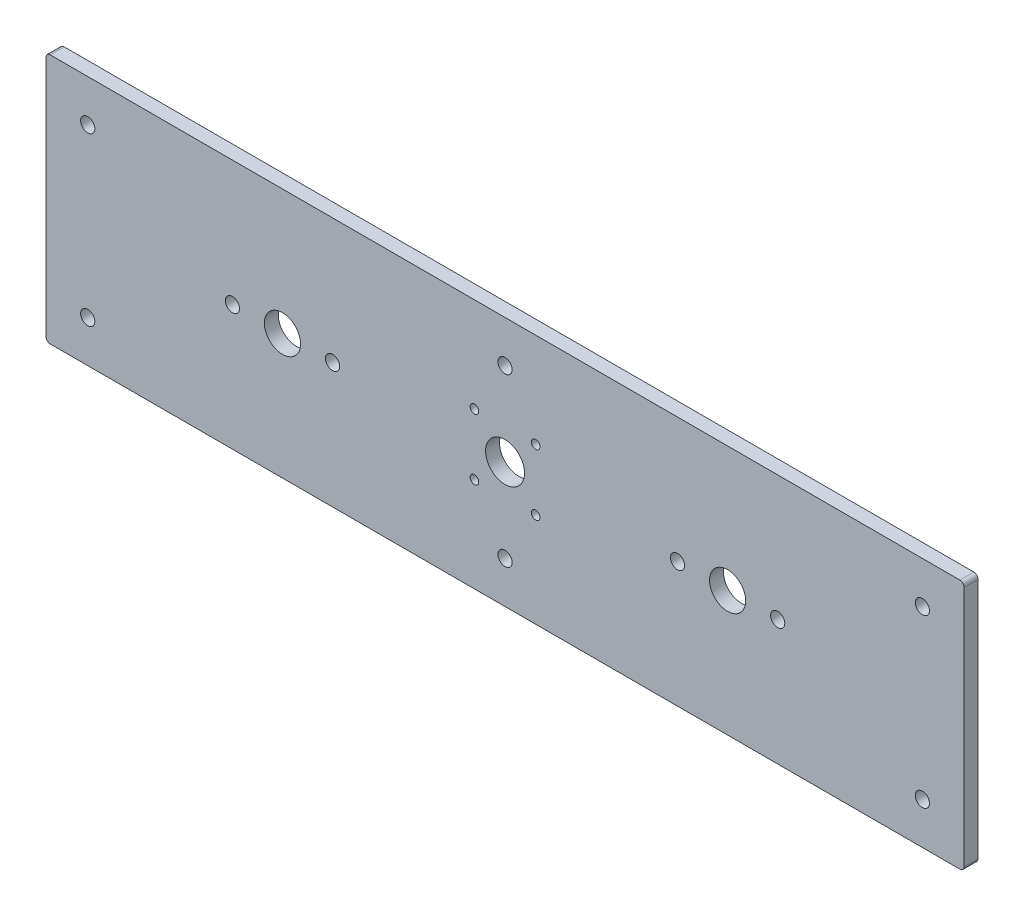
from build123d import *

# Parameters (mm, degrees)
SKETCH1_W           = 330
SKETCH1_H           = 90
BOSS_EXTRUDE1_DEPTH = 2.5
SKETCH2_R           = 2.55
CUT_EXTRUDE1_DEPTH  = 172.099386323
SKETCH3_R           = 6.5
SKETCH3_R_2         = 2.55
CUT_EXTRUDE2_DEPTH  = 172.099386323
SKETCH4_R           = 1.55
SKETCH4_R_2         = 7
CUT_EXTRUDE3_DEPTH  = 172.099386323
FILLET1_R           = 1.5


with BuildPart() as part:
    # Sketch1 → Boss-Extrude1 (new, symmetric)
    with BuildSketch(Plane.XY):
        Rectangle(SKETCH1_W, SKETCH1_H)
    extrude(amount=BOSS_EXTRUDE1_DEPTH, both=True)

    # Sketch2 → Cut-Extrude1 (cut, through all)
    with BuildSketch(Plane.XY.offset(2.5)):
        with Locations((150, 30)):
            Circle(SKETCH2_R)
        with Locations((150, -30)):
            Circle(SKETCH2_R)
        with Locations((0, 30)):
            Circle(SKETCH2_R)
        with Locations((0, -30)):
            Circle(SKETCH2_R)
        with Locations((-150, -30)):
            Circle(SKETCH2_R)
        with Locations((-150, 30)):
            Circle(SKETCH2_R)
    extrude(amount=-CUT_EXTRUDE1_DEPTH, mode=Mode.SUBTRACT)

    # Sketch3 → Cut-Extrude2 (cut, through all)
    with BuildSketch(Plane.XY.offset(2.5)):
        with Locations((-80, 0)):
            Circle(SKETCH3_R)
        with Locations((-62, 0)):
            Circle(SKETCH3_R_2)
        with Locations((-98, 0)):
            Circle(SKETCH3_R_2)
    cut_extrude2 = extrude(amount=-CUT_EXTRUDE2_DEPTH, mode=Mode.SUBTRACT)

    # Mirror1: Cut-Extrude2 across plane
    add(cut_extrude2.mirror(Plane(origin=(0, 0, 0), x_dir=(0, 0, 1), z_dir=(1, 0, 0))), mode=Mode.SUBTRACT)

    # Sketch4 → Cut-Extrude3 (cut, through all)
    with BuildSketch(Plane.XY.offset(2.5)):
        with Locations((11, 11)):
            Circle(SKETCH4_R)
        with Locations((11, -11)):
            Circle(SKETCH4_R)
        with Locations((-11, -11)):
            Circle(SKETCH4_R)
        with Locations((-11, 11)):
            Circle(SKETCH4_R)
        Circle(SKETCH4_R_2)
    extrude(amount=-CUT_EXTRUDE3_DEPTH, mode=Mode.SUBTRACT)

    # Fillet1
    fillet1_edges = [part.edges().sort_by_distance(p)[0] for p in [
        (-165, -45, 0),
        (-165, 45, 0),
        (165, -45, 0),
        (165, 45, 0),
    ]]
    fillet(fillet1_edges, radius=FILLET1_R)


solid = part.part
